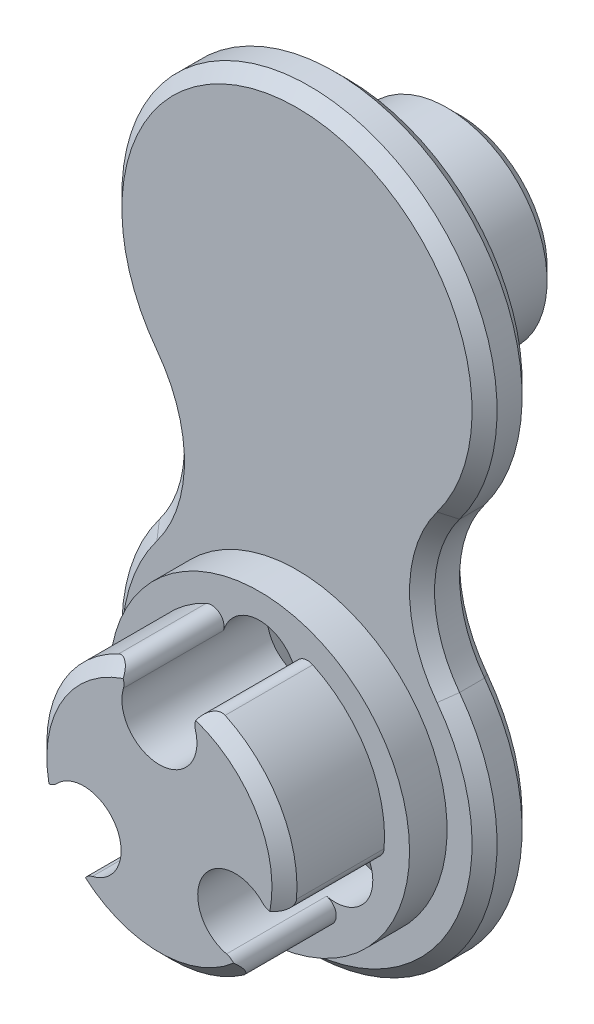
from build123d import *

# Parameters (mm, degrees)
EXTRUDE_1_DEPTH     = 2
SKETCH_2_R          = 6
EXTRUDE_2_DEPTH     = 1.5
SKETCH_3_R          = 5
EXTRUDE_3_DEPTH     = 4
SKETCH_4_R          = 5
EXTRUDE_4_DEPTH     = 1
SKETCH_5_R          = 4
EXTRUDE_5_DEPTH     = 3.5
CUT_EXTRUDE_1_DEPTH = 27.58006772
EXTRUDE_START       = -3.5
SKETCH_9_R          = 6
EXTRUDE_6_DEPTH     = 3.5
SKETCH_10_R         = 1.5
CUT_EXTRUDE_2_DEPTH = 26.029982022
CHAMFER_1_SIZE      = 1.7
CHAMFER_2_SIZE      = 0.5
CHAMFER_3_SIZE      = 0.5


with BuildPart() as part:
    # ｽｹｯﾁ1 → ﾎﾞｽ - 押し出し1 (new body)
    with BuildSketch(Plane.XY):
        with BuildLine():
            ThreePointArc((-6, 4.5), (0, -7.5), (6, 4.5))
            ThreePointArc((6, 4.5), (5, 7.5), (6, 10.5))
            ThreePointArc((6, 10.5), (0, 22.5), (-6, 10.5))
            ThreePointArc((-6, 10.5), (-5, 7.5), (-6, 4.5))
        make_face()
    extrude(amount=EXTRUDE_1_DEPTH)

    # ｽｹｯﾁ2 → ﾎﾞｽ - 押し出し2 (add)
    with BuildSketch(Plane.XY.offset(2)):
        with Locations(Location((0, 0, 0), (0, 0, 180))):
            Circle(SKETCH_2_R)
    extrude(amount=EXTRUDE_2_DEPTH)

    # ｽｹｯﾁ3 → ﾎﾞｽ - 押し出し3 (add)
    with BuildSketch(Plane.XY.offset(3.5)):
        Circle(SKETCH_3_R)
    extrude(amount=EXTRUDE_3_DEPTH)

    # ｽｹｯﾁ4 → ﾎﾞｽ - 押し出し4 (add)
    with BuildSketch(Plane(origin=(0, 0, 0), x_dir=(-1, 0, 0), z_dir=(0, 0, -1))):
        with Locations((0, 15)):
            Circle(SKETCH_4_R)
    extrude(amount=EXTRUDE_4_DEPTH)

    # ｽｹｯﾁ5 → ﾎﾞｽ - 押し出し5 (add)
    with BuildSketch(Plane(origin=(0, 0, -1), x_dir=(-1, 0, 0), z_dir=(0, 0, -1))):
        with Locations((0, 15)):
            Circle(SKETCH_5_R)
    extrude(amount=EXTRUDE_5_DEPTH)

    # ｽｹｯﾁ8 → ｶｯﾄ - 押し出し1 (cut, through all)
    with BuildSketch(Plane.XY.offset(7.5)):
        with BuildLine():
            ThreePointArc((-1.437472271, 3.928571429), (0, 2), (1.437472271, 3.928571429))
            ThreePointArc((1.437472271, 3.928571429), (1.590604363, 4.45051627), (2.12958855, 4.523809524))
            ThreePointArc((2.12958855, 4.523809524), (0, 5), (-2.12958855, 4.523809524))
            ThreePointArc((-2.12958855, 4.523809524), (-1.590604363, 4.45051627), (-1.437472271, 3.928571429))
        make_face()
        with BuildLine():
            ThreePointArc((4.120978793, -0.71939821), (1.732050808, -1), (2.683506522, -3.209173218))
            ThreePointArc((2.683506522, -3.209173218), (3.058957968, -3.602761921), (2.852939695, -4.106182546))
            ThreePointArc((2.852939695, -4.106182546), (4.330127019, -2.5), (4.982528245, -0.417626978))
            ThreePointArc((4.982528245, -0.417626978), (4.649562331, -0.847754349), (4.120978793, -0.71939821))
        make_face()
        with BuildLine():
            ThreePointArc((-2.683506522, -3.209173218), (-1.732050808, -1), (-4.120978793, -0.71939821))
            ThreePointArc((-4.120978793, -0.71939821), (-4.649562331, -0.847754349), (-4.982528245, -0.417626978))
            ThreePointArc((-4.982528245, -0.417626978), (-4.330127019, -2.5), (-2.852939695, -4.106182546))
            ThreePointArc((-2.852939695, -4.106182546), (-3.058957968, -3.602761921), (-2.683506522, -3.209173218))
        make_face()
    extrude(amount=-CUT_EXTRUDE_1_DEPTH, mode=Mode.SUBTRACT)

    # ｽｹｯﾁ9 → ﾎﾞｽ - 押し出し6 (add)
    with BuildSketch(Plane.XY.offset(3.5).offset(EXTRUDE_START)):
        with Locations(Location((0, 0, 0), (0, 0, 180))):
            Circle(SKETCH_9_R)
    extrude(amount=EXTRUDE_6_DEPTH)

    # ｽｹｯﾁ10 → ｶｯﾄ - 押し出し2 (cut, through all)
    with BuildSketch(Plane.XY.offset(3.5)):
        with Locations(Location((0, 3.5, 0), (0, 0, 16.601549599))):
            Circle(SKETCH_10_R)
        with Locations(Location((-3.031088913, -1.75, 0), (0, 0, 283.398450401))):
            Circle(SKETCH_10_R)
        with Locations(Location((3.031088913, -1.75, 0), (0, 0, 43.398450401))):
            Circle(SKETCH_10_R)
    extrude(amount=-CUT_EXTRUDE_2_DEPTH, mode=Mode.SUBTRACT)

    # 面取り1
    # the kernel refuses this chamfer: 1.7 mm, written as the material it takes off along each edge
    with BuildSketch(Plane(origin=(0, 3.5, 0), x_dir=(0.9583148475000108, 0.28571428571394725, 0), z_dir=(0.28571428571394725, -0.9583148475000108, 0))) as chamfer_1_piece_1:
        Polygon((1.5 + CHAMFER_1_SIZE, 0), (1.5, CHAMFER_1_SIZE), (1.5, 0), align=None)
    revolve(axis=Axis((0, 3.5, 0), (0, 0, 1)), mode=Mode.SUBTRACT)
    with BuildSketch(Plane(origin=(-3.031088913, -1.75, 0), x_dir=(0.2317215940976018, -0.9727821456157932, 0), z_dir=(-0.9727821456157932, -0.2317215940976018, 0))) as chamfer_1_piece_2:
        Polygon((1.5 + CHAMFER_1_SIZE, 0), (1.5, CHAMFER_1_SIZE), (1.5, 0), align=None)
    revolve(axis=Axis((-3.031088913, -1.75, 0), (0, 0, 1)), mode=Mode.SUBTRACT)
    with BuildSketch(Plane(origin=(3.031088913, -1.75, 0), x_dir=(0.7265932534024093, 0.6870678599018457, 0), z_dir=(0.6870678599018457, -0.7265932534024093, 0))) as chamfer_1_piece_3:
        Polygon((1.5 + CHAMFER_1_SIZE, 0), (1.5, CHAMFER_1_SIZE), (1.5, 0), align=None)
    revolve(axis=Axis((3.031088913, -1.75, 0), (0, 0, 1)), mode=Mode.SUBTRACT)

    # 面取り2
    chamfer_2_edges = [part.edges().sort_by_distance(p)[0] for p in [
        (4, 15, -4.5),
        (0, 22.5, 0),
        (5, 7.5, 0),
        (0, -7.5, 0),
        (-5, 7.5, 0),
    ]]
    chamfer(chamfer_2_edges, length=CHAMFER_2_SIZE)

    # 面取り3
    # the kernel refuses this chamfer: 0.5 mm, written as the material it takes off along each edge
    with BuildSketch(Plane(origin=(10, 7.5, 2), x_dir=(-0.7999999999999996, -0.6000000000000005, 0), z_dir=(0.6000000000000005, -0.7999999999999996, 0))) as chamfer_3_piece_1:
        Polygon((5, CHAMFER_3_SIZE), (5 + CHAMFER_3_SIZE, 0), (5, 0), align=None)
    revolve(axis=Axis((10, 7.5, 2), (0, 0, -1)), revolution_arc=73.739795292, mode=Mode.SUBTRACT)
    with BuildSketch(Plane(origin=(0, 15, 2), x_dir=(0.7999999999999998, -0.6000000000000002, 0), z_dir=(-0.6000000000000002, -0.7999999999999998, 0))) as chamfer_3_piece_2:
        Polygon((7.5 - CHAMFER_3_SIZE, 0), (7.5, -CHAMFER_3_SIZE), (7.5, 0), align=None)
    revolve(axis=Axis((0, 15, 2), (0, 0, 1)), revolution_arc=253.739795292, mode=Mode.SUBTRACT)
    with BuildSketch(Plane(origin=(0, 0, 7.5), x_dir=(-0.18173044344345904, 0.9833483848188515, 0), z_dir=(0.9833483848188515, 0.18173044344345904, 0))) as chamfer_3_piece_3:
        Polygon((5, -CHAMFER_3_SIZE), (5 - CHAMFER_3_SIZE, 0), (5, 0), align=None)
    revolve(axis=Axis((0, 0, 7.5), (0, 0, 1)), revolution_arc=99.05886102, mode=Mode.SUBTRACT)
    with BuildSketch(Plane(origin=(-10, 7.5, 2), x_dir=(0.8, 0.6, 0), z_dir=(-0.6, 0.8, 0))) as chamfer_3_piece_4:
        Polygon((5 + CHAMFER_3_SIZE, 0), (5, CHAMFER_3_SIZE), (5, 0), align=None)
    revolve(axis=Axis((-10, 7.5, 2), (0, 0, -1)), revolution_arc=73.739795292, mode=Mode.SUBTRACT)
    with BuildSketch(Plane(origin=(0, 0, 7.5), x_dir=(0.9424699037452493, -0.3342910117463833, 0), z_dir=(-0.3342910117463833, -0.9424699037452493, 0))) as chamfer_3_piece_5:
        Polygon((5, -CHAMFER_3_SIZE), (5 - CHAMFER_3_SIZE, 0), (5, 0), align=None)
    revolve(axis=Axis((0, 0, 7.5), (0, 0, 1)), revolution_arc=99.05886102, mode=Mode.SUBTRACT)
    with BuildSketch(Plane(origin=(0, 0, 7.5), x_dir=(-0.7607394603017978, -0.6490573730724652, 0), z_dir=(-0.6490573730724652, 0.7607394603017978, 0))) as chamfer_3_piece_6:
        Polygon((5, -CHAMFER_3_SIZE), (5 - CHAMFER_3_SIZE, 0), (5, 0), align=None)
    revolve(axis=Axis((0, 0, 7.5), (0, 0, 1)), revolution_arc=99.05886102, mode=Mode.SUBTRACT)
    with BuildSketch(Plane(origin=(0, 0, 2), x_dir=(-0.7999999999999997, 0.6000000000000003, 0), z_dir=(0.6000000000000003, 0.7999999999999997, 0))) as chamfer_3_piece_7:
        Polygon((7.5, -CHAMFER_3_SIZE), (7.5 - CHAMFER_3_SIZE, 0), (7.5, 0), align=None)
    revolve(axis=Axis((0, 0, 2), (0, 0, 1)), revolution_arc=253.739795292, mode=Mode.SUBTRACT)


solid = part.part
